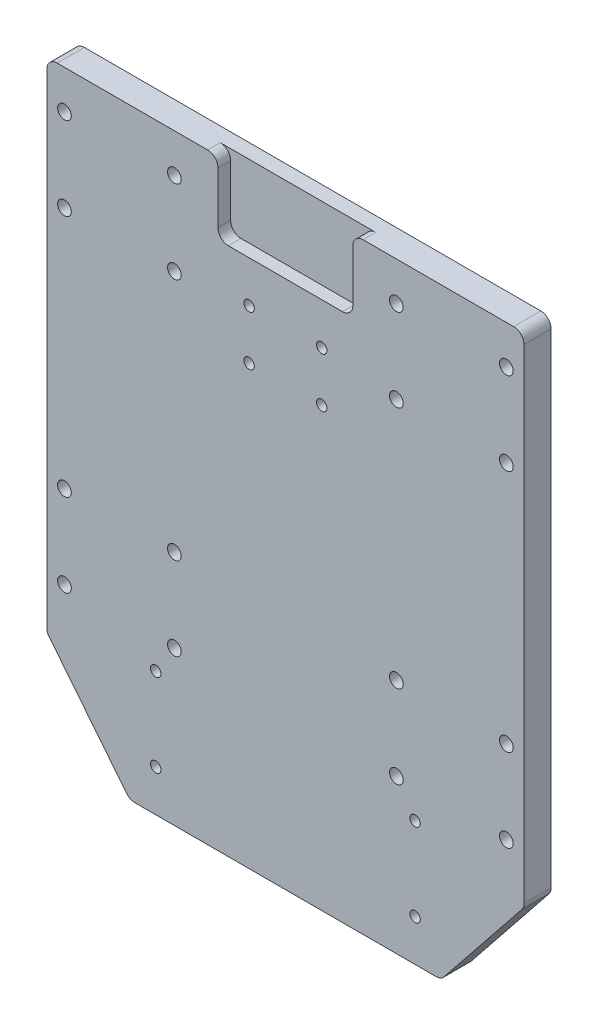
from build123d import *

# Parameters (mm, degrees)
BOSS_EXTRUDE1_DEPTH   = 13.1
FILLET1_R             = 5
SKETCH2_W             = 65
SKETCH2_H             = 35
CUT_EXTRUDE1_DEPTH    = 206.661396475
FILLET2_R             = 5
SKETCH3_W             = 109.473839025
SKETCH3_H             = 48.944636842
BOSS_EXTRUDE2_DEPTH   = 7
SKETCH5_R             = 3.3
CUT_EXTRUDE2_DEPTH    = 206.661396475
SKETCH6_R             = 2.5
CUT_EXTRUDE3_DEPTH    = 206.661396475
SKETCH8_R             = 2.5
CUT_EXTRUDE4_DEPTH    = 206.661396475
SKETCH9_R             = 5.5
CUT_EXTRUDE5_DEPTH    = 6
BODY_MOVE_COPY1_ANGLE = 180


with BuildPart() as part:
    # Sketch1 → Boss-Extrude1 (new body)
    with BuildSketch(Plane.XY):
        Polygon((115, -120), (115, 120), (-115, 120), (-115, -120), (-75, -170), (75, -170), align=None)
    extrude(amount=BOSS_EXTRUDE1_DEPTH)

    # Fillet1
    fillet1_edges = [part.edges().sort_by_distance(p)[0] for p in [
        (-115, 120, 6.55),
        (115, 120, 6.55),
        (75, -170, 6.55),
        (-75, -170, 6.55),
        (-115, -120, 6.55),
        (115, -120, 6.55),
    ]]
    fillet(fillet1_edges, radius=FILLET1_R)

    # Sketch2 → Cut-Extrude1 (cut, through all)
    with BuildSketch(Plane.XY.offset(13.1)):
        with Locations((0, 102.5)):
            Rectangle(SKETCH2_W, SKETCH2_H)
    extrude(amount=-CUT_EXTRUDE1_DEPTH, mode=Mode.SUBTRACT)

    # Fillet2
    fillet2_edges = [part.edges().sort_by_distance(p)[0] for p in [
        (32.5, 85, 6.55),
        (32.5, 120, 6.55),
        (-32.5, 85, 6.55),
        (-32.5, 120, 6.55),
    ]]
    fillet(fillet2_edges, radius=FILLET2_R)

    # Sketch3 → Boss-Extrude2 (add)
    with BuildSketch(Plane.XY.offset(13.1)):
        with Locations((2.558327619, 95.527681579)):
            Rectangle(SKETCH3_W, SKETCH3_H)
    extrude(amount=-BOSS_EXTRUDE2_DEPTH)

    # Sketch5 → Cut-Extrude2 (cut, through all)
    with BuildSketch(Plane.XY.offset(13.1)):
        with Locations((106.5, 101.37)):
            Circle(SKETCH5_R)
        with Locations((53.5, 101.37)):
            Circle(SKETCH5_R)
        with Locations((53.5, 61.37)):
            Circle(SKETCH5_R)
        with Locations((106.5, 61.37)):
            Circle(SKETCH5_R)
        with Locations((-53.5, 101.37)):
            Circle(SKETCH5_R)
        with Locations((-106.5, 101.37)):
            Circle(SKETCH5_R)
        with Locations((-106.5, 61.37)):
            Circle(SKETCH5_R)
        with Locations((-53.5, 61.37)):
            Circle(SKETCH5_R)
        with Locations((-106.5, -55.89)):
            Circle(SKETCH5_R)
        with Locations((-53.5, -55.89)):
            Circle(SKETCH5_R)
        with Locations((-53.5, -95.89)):
            Circle(SKETCH5_R)
        with Locations((-106.5, -95.89)):
            Circle(SKETCH5_R)
        with Locations((53.5, -55.89)):
            Circle(SKETCH5_R)
        with Locations((106.5, -55.89)):
            Circle(SKETCH5_R)
        with Locations((106.5, -95.89)):
            Circle(SKETCH5_R)
        with Locations((53.5, -95.89)):
            Circle(SKETCH5_R)
    extrude(amount=-CUT_EXTRUDE2_DEPTH, mode=Mode.SUBTRACT)

    # Sketch6 → Cut-Extrude3 (cut, through all)
    with BuildSketch(Plane.XY.offset(13.1)):
        with Locations((17.5, 64.95)):
            Circle(SKETCH6_R)
        with Locations((17.5, 40.95)):
            Circle(SKETCH6_R)
        with Locations((-17.5, 64.95)):
            Circle(SKETCH6_R)
        with Locations((-17.5, 40.95)):
            Circle(SKETCH6_R)
    extrude(amount=-CUT_EXTRUDE3_DEPTH, mode=Mode.SUBTRACT)

    # Sketch8 → Cut-Extrude4 (cut, through all)
    with BuildSketch(Plane.XY.offset(13.1)):
        with Locations((62.5, -110)):
            Circle(SKETCH8_R)
        with Locations((62.5, -150)):
            Circle(SKETCH8_R)
        with Locations((-62.5, -110)):
            Circle(SKETCH8_R)
        with Locations((-62.5, -150)):
            Circle(SKETCH8_R)
    extrude(amount=-CUT_EXTRUDE4_DEPTH, mode=Mode.SUBTRACT)

    # Sketch9 → Cut-Extrude5 (cut)
    with BuildSketch(Plane.XY.offset(13.1)):
        with Locations((53.5, -95.89)):
            Circle(SKETCH9_R)
        with Locations((-53.5, -95.89)):
            Circle(SKETCH9_R)
    extrude(amount=-CUT_EXTRUDE5_DEPTH, mode=Mode.SUBTRACT)


with BuildPart() as part_1:
    # Body-Move/Copy1: moved
    add(part.part.rotate(Axis((0, 0, 6), (0, 1, 0)), BODY_MOVE_COPY1_ANGLE))


solid = part_1.part
